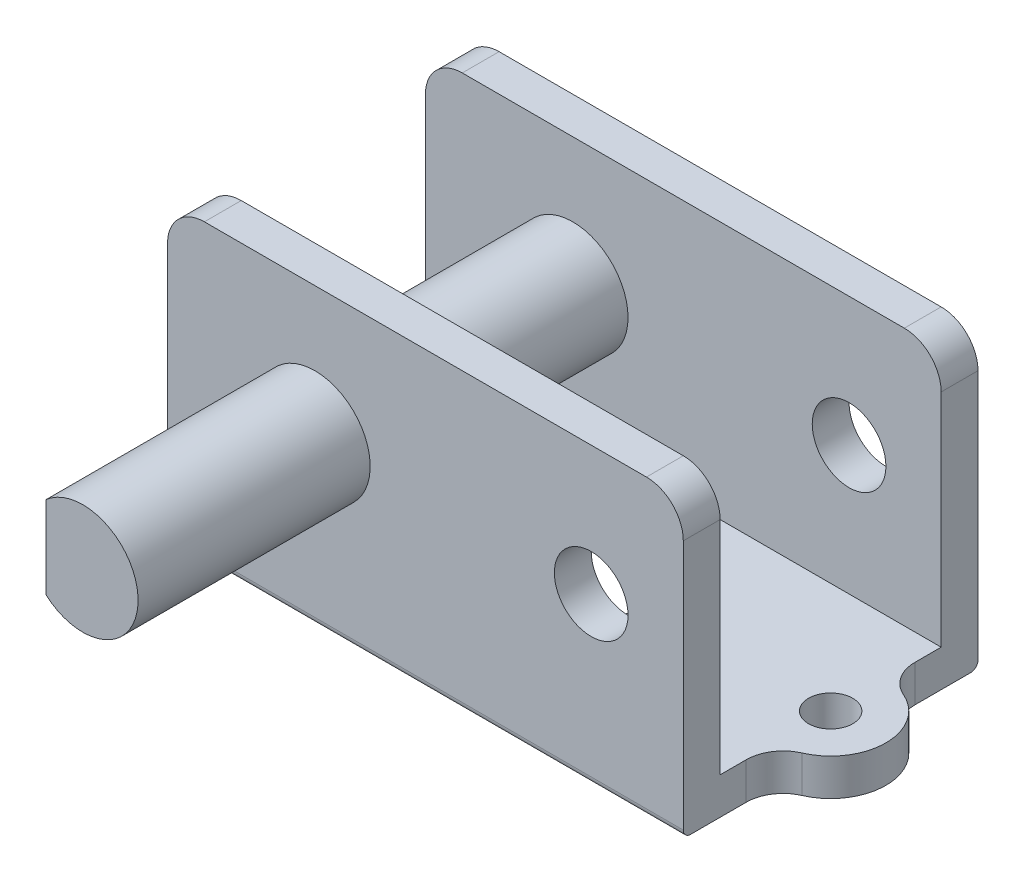
from build123d import *

# Parameters (mm, degrees)
EXTRUDE1_DEPTH      = 4
EXTRUDE2_DEPTH      = 12.357816692
EXTRUDE2_DEPTH_BACK = 12.357816692
SKETCH2_R           = 1
EXTRUDE3_DEPTH      = 12.357816692
EXTRUDE3_DEPTH_BACK = 12.357816692
FILLET1_R           = 0.2
FILLET2_R           = 1
EXTRUDE4_DEPTH      = 14
EXTRUDE4_DEPTH_BACK = 3
SKETCH5_W           = 0.95644391
SKETCH5_H           = 3.560686456
EXTRUDE5_DEPTH      = 9
EXTRUDE6_DEPTH      = 1
SKETCH7_R           = 0.6
EXTRUDE7_DEPTH      = 1
FILLET3_R           = 1
SKETCH8_R           = 2
EXTRUDE8_DEPTH      = 1
EXTRUDE9_START      = 6.3
SKETCH9_R           = 2.172550551
EXTRUDE9_DEPTH      = 10


with BuildPart() as part:
    # Sketch1 → Extrude1 (new, symmetric)
    with BuildSketch(Plane.XY):
        Polygon((0, 0), (-7, 0), (-7, 8), (7, 8), (7, 0), align=None)
    extrude(amount=EXTRUDE1_DEPTH, both=True)

    # Sketch2 → Extrude2 (cut, two sides: drawn at the far end of the back side and taken through both)
    with BuildSketch(Plane.XY.offset(-EXTRUDE2_DEPTH_BACK)):
        with Locations((4.5, 4.5)):
            Circle(SKETCH2_R)
    extrude(amount=EXTRUDE2_DEPTH + EXTRUDE2_DEPTH_BACK, mode=Mode.SUBTRACT)

    # Sketch4 → Extrude3 (cut, two sides: drawn at the far end of the back side and taken through both)
    with BuildSketch(Plane(origin=(0, 0, 0), x_dir=(0, 0, -1), z_dir=(1, 0, 0)).offset(-EXTRUDE3_DEPTH_BACK)):
        Polygon((0, 1), (3, 1), (3, 9.732029078), (-3, 9.732029078), (-3, 1), align=None)
    extrude(amount=EXTRUDE3_DEPTH + EXTRUDE3_DEPTH_BACK, mode=Mode.SUBTRACT)

    # Fillet1
    fillet1_edges = [part.edges().sort_by_distance(p)[0] for p in [
        (0, 0, 4),
        (0, 0, -4),
    ]]
    fillet(fillet1_edges, radius=FILLET1_R)

    # Fillet2
    fillet2_edges = [part.edges().sort_by_distance(p)[0] for p in [
        (7, 8, -3.5),
        (7, 8, 3.5),
        (-7, 8, -3.5),
        (-7, 8, 3.5),
    ]]
    fillet(fillet2_edges, radius=FILLET2_R)

    # Sketch3 → Extrude4 (add, two sides: drawn at the far end of the back side and taken through both)
    with BuildSketch(Plane.XY.offset(-EXTRUDE4_DEPTH_BACK)):
        with BuildLine():
            ThreePointArc((-3, 6), (-4.060660172, 3.439339828), (-1.5, 4.5))
            ThreePointArc((-1.5, 4.5), (-1.939339828, 5.560660172), (-3, 6))
        make_face()
    extrude(amount=EXTRUDE4_DEPTH + EXTRUDE4_DEPTH_BACK)

    # Sketch5 → Extrude5 (cut)
    with BuildSketch(Plane.XY.offset(14)):
        with Locations((-4.478221955, 4.280343228)):
            Rectangle(SKETCH5_W, SKETCH5_H)
    extrude(amount=-EXTRUDE5_DEPTH, mode=Mode.SUBTRACT)

    # Sketch6 → Extrude6 (add)
    with BuildSketch(Plane.XZ):
        with BuildLine():
            ThreePointArc((-5.910714286, -1.031240337), (-6, 0), (-5.910714286, 1.031240337))
            ThreePointArc((-5.910714286, 1.031240337), (-8.5, 0), (-5.910714286, -1.031240337))
        make_face()
        with BuildLine():
            ThreePointArc((7, -1.5), (8.5, 0), (7, 1.5))
            Line((7, 1.5), (7, -1.5))
        make_face()
    extrude(amount=-EXTRUDE6_DEPTH)

    # Sketch7 → Extrude7 (cut)
    with BuildSketch(Plane.XZ):
        with Locations((-7, 0)):
            Circle(SKETCH7_R)
        with Locations((7, 0)):
            Circle(SKETCH7_R)
    extrude(amount=-EXTRUDE7_DEPTH, mode=Mode.SUBTRACT)

    # Fillet3
    fillet3_edges = [part.edges().sort_by_distance(p)[0] for p in [
        (7, 0.5, -1.5),
        (7, 0.5, 1.5),
        (-7, 0.5, -1.5),
        (-7, 0.5, 1.5),
    ]]
    fillet(fillet3_edges, radius=FILLET3_R)

    # Sketch8 → Extrude8 (cut)
    with BuildSketch(Plane.XZ):
        Circle(SKETCH8_R)
    extrude(amount=-EXTRUDE8_DEPTH, mode=Mode.SUBTRACT)

    # Sketch9 → Extrude9 (cut)
    with BuildSketch(Plane.XY.offset(4).offset(EXTRUDE9_START)):
        with Locations((-3, 4.5)):
            Circle(SKETCH9_R)
    extrude(amount=EXTRUDE9_DEPTH, mode=Mode.SUBTRACT)


solid = part.part
